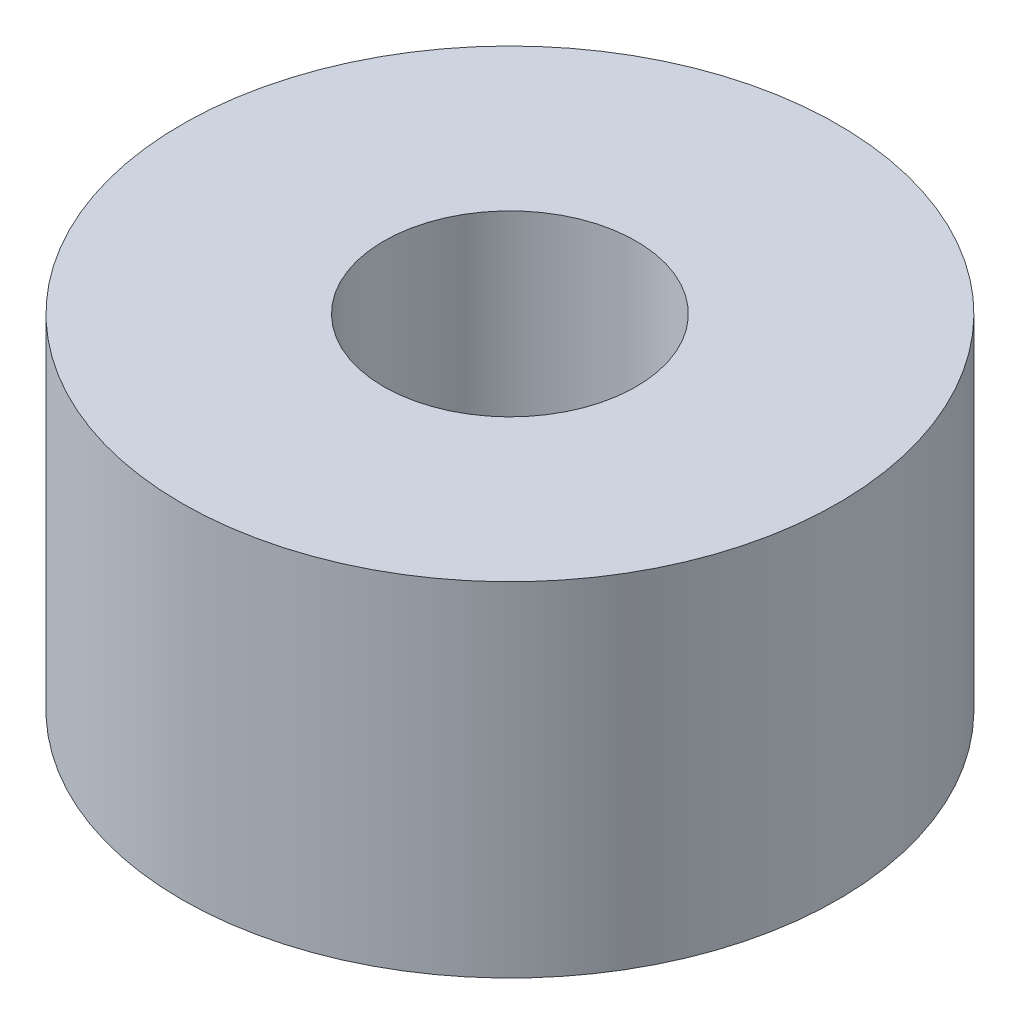
from build123d import *

# Parameters (mm, degrees)
SKETCH1_R   = 3.25
SKETCH1_R_2 = 1.25
BODY_DEPTH  = 3.4


with BuildPart() as part:
    # Sketch1 → Body (new body)
    with BuildSketch(Plane(origin=(0, 0, 0), x_dir=(1, 0, 0), z_dir=(0, 1, 0))):
        Circle(SKETCH1_R)
        Circle(SKETCH1_R_2, mode=Mode.SUBTRACT)
    extrude(amount=BODY_DEPTH)


solid = part.part
